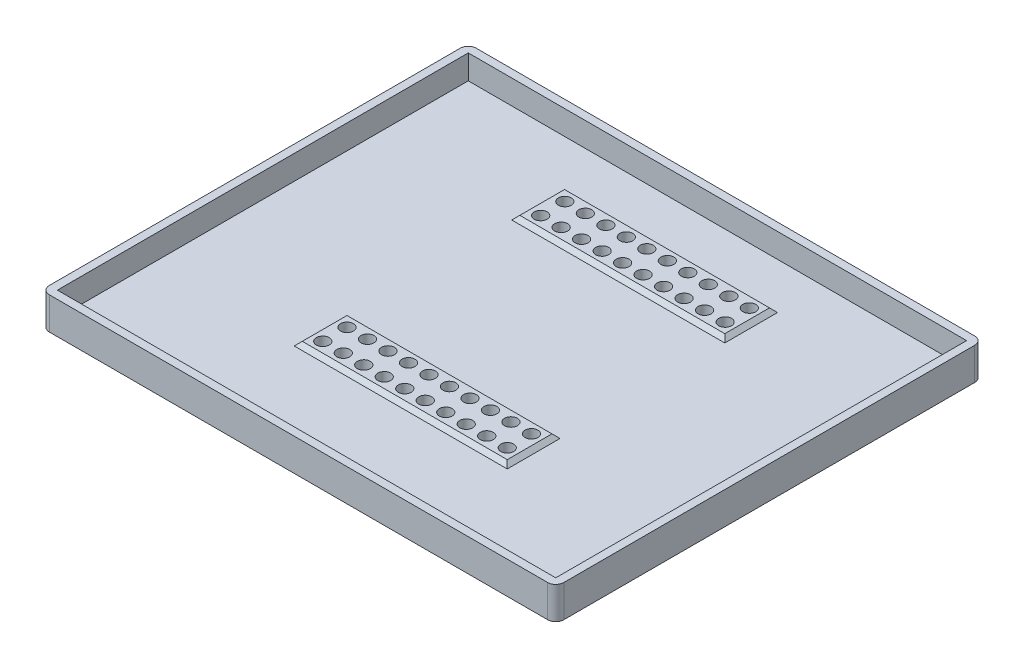
from build123d import *

# Parameters (mm, degrees)
SKETCH_1_W          = 63.76
SKETCH_1_H          = 52.92
EXTRUDE_1_DEPTH     = 1
FILLET_1_R          = 1
SKETCH_2_W          = 25.4
SKETCH_2_H          = 5.54
EXTRUDE_2_DEPTH     = 0.5
CHAMFER_1_SIZE      = 0.5
SKETCH_3_R          = 0.8
CUT_EXTRUDE_2_DEPTH = 52.633662839
EXTRUDE_START       = 3
SKETCH_4_W          = 61.76
SKETCH_4_H          = 50.92
EXTRUDE_3_DEPTH     = 3


with BuildPart() as part:
    # 草图1 → 凸台-拉伸1 (new body)
    with BuildSketch(Plane(origin=(0, 0, 0), x_dir=(1, 0, 0), z_dir=(0, 1, 0))):
        with Locations((-7.873913043, -6.455217391)):
            Rectangle(SKETCH_1_W, SKETCH_1_H)
    extrude(amount=EXTRUDE_1_DEPTH)

    # 圆角1
    fillet_1_edges = [part.edges().sort_by_distance(p)[0] for p in [
        (-39.753913043, 0.5, -20.004782609),
        (24.006086957, 0.5, -20.004782609),
        (24.006086957, 0.5, 32.915217391),
        (-39.753913043, 0.5, 32.915217391),
    ]]
    fillet(fillet_1_edges, radius=FILLET_1_R)

    # 草图2 → 凸台-拉伸2 (add)
    with BuildSketch(Plane(origin=(0, 1, 0), x_dir=(1, 0, 0), z_dir=(0, 1, 0))):
        with Locations((-7.924409429, 10.034782609)):
            Rectangle(SKETCH_2_W, SKETCH_2_H)
        with Locations((-7.883913043, -16.965217391)):
            Rectangle(SKETCH_2_W, SKETCH_2_H)
    extrude(amount=EXTRUDE_2_DEPTH)

    # 倒角1
    chamfer_1_edges = [part.edges().sort_by_distance(p)[0] for p in [
        (4.816086957, 1, 16.965217391),
        (-7.883913043, 1, 14.195217391),
        (-7.883913043, 1, 19.735217391),
        (-20.583913043, 1, 16.965217391),
        (-20.624409429, 1, -10.034782609),
        (-7.924409429, 1, -12.804782609),
        (4.775590571, 1, -10.034782609),
        (-7.924409429, 1, -7.264782609),
    ]]
    chamfer(chamfer_1_edges, length=CHAMFER_1_SIZE - 0.0001)  # a hair under: the kernel refuses the full size

    # 草图3 → 切除-拉伸2 (cut, through all)
    with BuildSketch(Plane.XZ):
        with Locations(Location((-19.313913043, 18.465217391, 0), (0, 0, 270))):
            Circle(SKETCH_3_R)
        with Locations(Location((-16.773913043, 18.465217391, 0), (0, 0, 270))):
            Circle(SKETCH_3_R)
        with Locations(Location((-14.233913043, 18.465217391, 0), (0, 0, 270))):
            Circle(SKETCH_3_R)
        with Locations(Location((-11.693913043, 18.465217391, 0), (0, 0, 270))):
            Circle(SKETCH_3_R)
        with Locations(Location((-9.153913043, 18.465217391, 0), (0, 0, 270))):
            Circle(SKETCH_3_R)
        with Locations(Location((-6.613913043, 18.465217391, 0), (0, 0, 270))):
            Circle(SKETCH_3_R)
        with Locations(Location((-4.073913043, 18.465217391, 0), (0, 0, 270))):
            Circle(SKETCH_3_R)
        with Locations(Location((-1.533913043, 18.465217391, 0), (0, 0, 270))):
            Circle(SKETCH_3_R)
        with Locations(Location((1.006086957, 18.465217391, 0), (0, 0, 270))):
            Circle(SKETCH_3_R)
        with Locations(Location((3.546086957, 18.465217391, 0), (0, 0, 270))):
            Circle(SKETCH_3_R)
        with Locations(Location((-16.773913043, 15.465217391, 0), (0, 0, 270))):
            Circle(SKETCH_3_R)
        with Locations(Location((-14.233913043, 15.465217391, 0), (0, 0, 270))):
            Circle(SKETCH_3_R)
        with Locations(Location((-11.693913043, 15.465217391, 0), (0, 0, 270))):
            Circle(SKETCH_3_R)
        with Locations(Location((-9.153913043, 15.465217391, 0), (0, 0, 270))):
            Circle(SKETCH_3_R)
        with Locations(Location((-6.613913043, 15.465217391, 0), (0, 0, 270))):
            Circle(SKETCH_3_R)
        with Locations(Location((-4.073913043, 15.465217391, 0), (0, 0, 270))):
            Circle(SKETCH_3_R)
        with Locations(Location((-1.533913043, 15.465217391, 0), (0, 0, 270))):
            Circle(SKETCH_3_R)
        with Locations(Location((1.006086957, 15.465217391, 0), (0, 0, 270))):
            Circle(SKETCH_3_R)
        with Locations(Location((3.546086957, 15.465217391, 0), (0, 0, 270))):
            Circle(SKETCH_3_R)
        with Locations(Location((-19.313913043, 15.465217391, 0), (0, 0, 270))):
            Circle(SKETCH_3_R)
        with Locations(Location((-19.313913043, -8.534782609, 0), (0, 0, 270))):
            Circle(SKETCH_3_R)
        with Locations(Location((-16.773913043, -8.534782609, 0), (0, 0, 270))):
            Circle(SKETCH_3_R)
        with Locations(Location((-14.233913043, -8.534782609, 0), (0, 0, 270))):
            Circle(SKETCH_3_R)
        with Locations(Location((-11.693913043, -8.534782609, 0), (0, 0, 270))):
            Circle(SKETCH_3_R)
        with Locations(Location((-9.153913043, -8.534782609, 0), (0, 0, 270))):
            Circle(SKETCH_3_R)
        with Locations(Location((-6.613913043, -8.534782609, 0), (0, 0, 270))):
            Circle(SKETCH_3_R)
        with Locations(Location((-4.073913043, -8.534782609, 0), (0, 0, 270))):
            Circle(SKETCH_3_R)
        with Locations(Location((-1.533913043, -8.534782609, 0), (0, 0, 270))):
            Circle(SKETCH_3_R)
        with Locations(Location((1.006086957, -8.534782609, 0), (0, 0, 270))):
            Circle(SKETCH_3_R)
        with Locations(Location((3.546086957, -8.534782609, 0), (0, 0, 270))):
            Circle(SKETCH_3_R)
        with Locations(Location((-16.773913043, -11.534782609, 0), (0, 0, 270))):
            Circle(SKETCH_3_R)
        with Locations(Location((-14.233913043, -11.534782609, 0), (0, 0, 270))):
            Circle(SKETCH_3_R)
        with Locations(Location((-11.693913043, -11.534782609, 0), (0, 0, 270))):
            Circle(SKETCH_3_R)
        with Locations(Location((-9.153913043, -11.534782609, 0), (0, 0, 270))):
            Circle(SKETCH_3_R)
        with Locations(Location((-6.613913043, -11.534782609, 0), (0, 0, 270))):
            Circle(SKETCH_3_R)
        with Locations(Location((-4.073913043, -11.534782609, 0), (0, 0, 270))):
            Circle(SKETCH_3_R)
        with Locations(Location((-1.533913043, -11.534782609, 0), (0, 0, 270))):
            Circle(SKETCH_3_R)
        with Locations(Location((1.006086957, -11.534782609, 0), (0, 0, 270))):
            Circle(SKETCH_3_R)
        with Locations(Location((3.546086957, -11.534782609, 0), (0, 0, 270))):
            Circle(SKETCH_3_R)
        with Locations(Location((-19.313913043, -11.534782609, 0), (0, 0, 270))):
            Circle(SKETCH_3_R)
    extrude(amount=-CUT_EXTRUDE_2_DEPTH, mode=Mode.SUBTRACT)

    # 草图4 → 凸台-拉伸3 (add)
    with BuildSketch(Plane(origin=(0, 1, 0), x_dir=(1, 0, 0), z_dir=(0, 1, 0)).offset(EXTRUDE_START)):
        with BuildLine():
            Line((-38.753913043, -32.915217391), (23.006086957, -32.915217391))
            ThreePointArc((23.006086957, -32.915217391), (23.713193738, -32.622324172), (24.006086957, -31.915217391))
            Line((24.006086957, -31.915217391), (24.006086957, 19.004782609))
            ThreePointArc((24.006086957, 19.004782609), (23.713193738, 19.71188939), (23.006086957, 20.004782609))
            Line((23.006086957, 20.004782609), (-38.753913043, 20.004782609))
            ThreePointArc((-38.753913043, 20.004782609), (-39.461019825, 19.71188939), (-39.753913043, 19.004782609))
            Line((-39.753913043, 19.004782609), (-39.753913043, -31.915217391))
            ThreePointArc((-39.753913043, -31.915217391), (-39.461019825, -32.622324172), (-38.753913043, -32.915217391))
        make_face()
        with Locations((-7.873913043, -6.455217391)):
            Rectangle(SKETCH_4_W, SKETCH_4_H, mode=Mode.SUBTRACT)
    extrude(amount=-EXTRUDE_3_DEPTH)


solid = part.part
